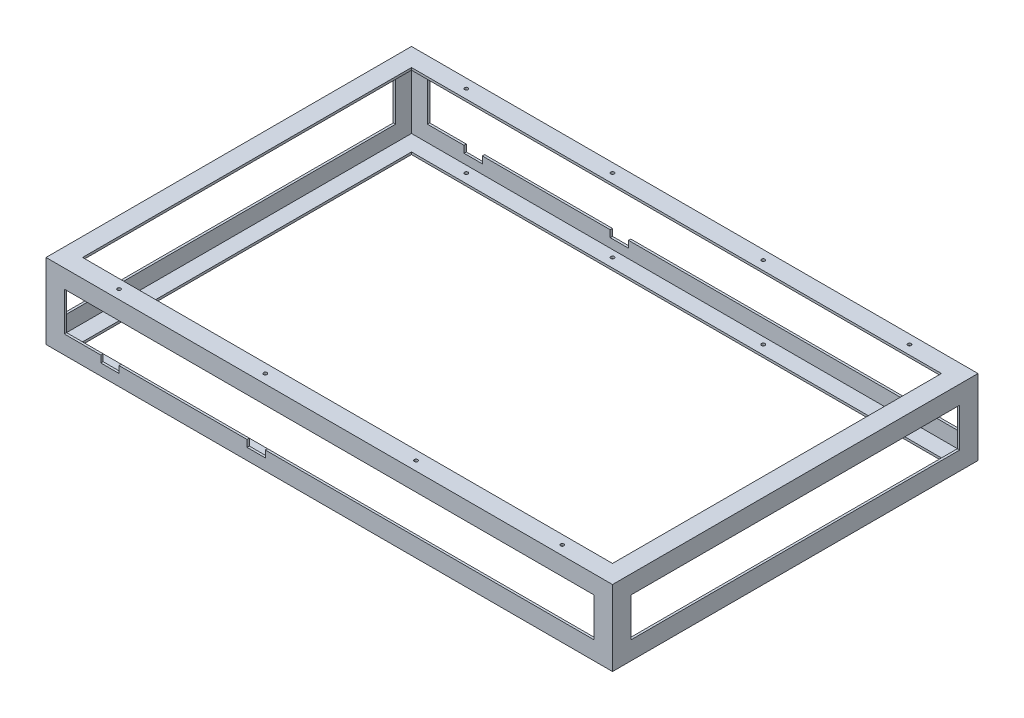
from build123d import *

# Parameters (mm, degrees)
X_ANGLE_LENTH_DEPTH             = 1574.8
X_ANGLE_LENTH_2_DEPTH           = 1574.8
X_ANGLE_LENTH_3_DEPTH           = 1574.8
X_ANGLE_LENTH_4_DEPTH           = 1574.8
Y_ANGLE_LENTH_DEPTH             = 209.55
Z_ANGLE_LENTH_REACH             = 1684.546
Z_ANGLE_LENTH_DIRECTION_2_REACH = 1684.546
SKETCH16_R                      = 4.7625
WHEEL_MOUNT_LOC_HOLES_DEPTH     = 1668.923931869
SKETCH17_W                      = 50.8
SKETCH17_H                      = 38.1
FRONT_CONTROL_ARM_CUTOUTS_DEPTH = 1899.724329649


with BuildPart() as part:
    # Sketch5 → X Angle Lenth (new body)
    with BuildSketch(Plane(origin=(0, 0, 0), x_dir=(0, 0, -1), z_dir=(1, 0, 0))):
        Polygon((-508, -304.8), (-508, -254), (-501.65, -254), (-501.65, -298.45), (-457.2, -298.45), (-457.2, -304.8), align=None)
    extrude(amount=X_ANGLE_LENTH_DEPTH)



with BuildPart() as body_2:
    # Sketch5 → X Angle Lenth 2 (new body)
    with BuildSketch(Plane(origin=(0, 0, 0), x_dir=(0, 0, -1), z_dir=(1, 0, 0))):
        Polygon((501.65, -254), (508, -254), (508, -304.8), (457.2, -304.8), (457.2, -298.45), (501.65, -298.45), align=None)
    extrude(amount=X_ANGLE_LENTH_2_DEPTH)


with BuildPart() as body_3:
    # Sketch5 → X Angle Lenth 3 (new body)
    with BuildSketch(Plane(origin=(0, 0, 0), x_dir=(0, 0, -1), z_dir=(1, 0, 0))):
        Polygon((508, -95.25), (508, -146.05), (501.65, -146.05), (501.65, -101.6), (457.2, -101.6), (457.2, -95.25), align=None)
    extrude(amount=X_ANGLE_LENTH_3_DEPTH)


with BuildPart() as body_4:
    # Sketch5 → X Angle Lenth 4 (new body)
    with BuildSketch(Plane(origin=(0, 0, 0), x_dir=(0, 0, -1), z_dir=(1, 0, 0))):
        Polygon((-501.65, -146.05), (-508, -146.05), (-508, -95.25), (-457.2, -95.25), (-457.2, -101.6), (-501.65, -101.6), align=None)
    extrude(amount=X_ANGLE_LENTH_4_DEPTH)


with BuildPart() as part_1:
    add(part.part)

    add(body_2.part)  # Y Angle Lenth merges body 2

    add(body_3.part)  # Y Angle Lenth merges body 3

    add(body_4.part)  # Y Angle Lenth merges body 4
    # Sketch6 → Y Angle Lenth (add)
    with BuildSketch(Plane.XZ.offset(304.8)):
        Polygon((1574.8, -508), (1524, -508), (1524, -501.65), (1568.45, -501.65), (1568.45, -457.2), (1574.8, -457.2), align=None)
        Polygon((1524, 501.65), (1524, 508), (1574.8, 508), (1574.8, 457.2), (1568.45, 457.2), (1568.45, 501.65), align=None)
        Polygon((0, 508), (50.8, 508), (50.8, 501.65), (6.35, 501.65), (6.35, 457.2), (0, 457.2), align=None)
        Polygon((50.8, -501.65), (50.8, -508), (0, -508), (0, -457.2), (6.35, -457.2), (6.35, -501.65), align=None)
    extrude(amount=-Y_ANGLE_LENTH_DEPTH)

    # Sketch15 → Z Angle Lenth (add, up to next)
    with BuildSketch(Plane.XY, mode=Mode.PRIVATE) as z_angle_lenth_sk1:
        Polygon((0, -254), (0, -304.8), (50.8, -304.8), (50.8, -298.45), (6.35, -298.45), (6.35, -254), align=None)
    z_angle_lenth_tool1 = extrude(z_angle_lenth_sk1.sketch, amount=-Z_ANGLE_LENTH_REACH, mode=Mode.PRIVATE) - part_1.part
    # Sketch15 → Z Angle Lenth (add, up to next)
    with BuildSketch(Plane.XY, mode=Mode.PRIVATE) as z_angle_lenth_sk2:
        Polygon((1568.45, -254), (1574.8, -254), (1574.8, -304.8), (1524, -304.8), (1524, -298.45), (1568.45, -298.45), align=None)
    z_angle_lenth_tool2 = extrude(z_angle_lenth_sk2.sketch, amount=-Z_ANGLE_LENTH_REACH, mode=Mode.PRIVATE) - part_1.part
    # Sketch15 → Z Angle Lenth (add, up to next)
    with BuildSketch(Plane.XY, mode=Mode.PRIVATE) as z_angle_lenth_sk3:
        Polygon((1574.8, -146.05), (1574.8, -95.25), (1524, -95.25), (1524, -101.6), (1568.45, -101.6), (1568.45, -146.05), align=None)
    z_angle_lenth_tool3 = extrude(z_angle_lenth_sk3.sketch, amount=-Z_ANGLE_LENTH_REACH, mode=Mode.PRIVATE) - part_1.part
    # Sketch15 → Z Angle Lenth (add, up to next)
    with BuildSketch(Plane.XY, mode=Mode.PRIVATE) as z_angle_lenth_sk4:
        Polygon((6.35, -146.05), (0, -146.05), (0, -95.25), (50.8, -95.25), (50.8, -101.6), (6.35, -101.6), align=None)
    z_angle_lenth_tool4 = extrude(z_angle_lenth_sk4.sketch, amount=-Z_ANGLE_LENTH_REACH, mode=Mode.PRIVATE) - part_1.part
    add(z_angle_lenth_tool1.solids().sort_by_distance((0.71842, -279.4, 0))[0])
    add(z_angle_lenth_tool2.solids().sort_by_distance((1571.625, -254.71842, 0))[0])
    add(z_angle_lenth_tool3.solids().sort_by_distance((1574.08158, -120.65, 0))[0])
    add(z_angle_lenth_tool4.solids().sort_by_distance((3.175, -145.33158, 0))[0])

    # Sketch15 → Z Angle Lenth direction 2 (add, up to next)
    with BuildSketch(Plane.XY, mode=Mode.PRIVATE) as z_angle_lenth_direction_2_sk1:
        Polygon((0, -254), (0, -304.8), (50.8, -304.8), (50.8, -298.45), (6.35, -298.45), (6.35, -254), align=None)
    z_angle_lenth_direction_2_tool1 = extrude(z_angle_lenth_direction_2_sk1.sketch, amount=Z_ANGLE_LENTH_DIRECTION_2_REACH, mode=Mode.PRIVATE) - part_1.part
    # Sketch15 → Z Angle Lenth direction 2 (add, up to next)
    with BuildSketch(Plane.XY, mode=Mode.PRIVATE) as z_angle_lenth_direction_2_sk2:
        Polygon((1568.45, -254), (1574.8, -254), (1574.8, -304.8), (1524, -304.8), (1524, -298.45), (1568.45, -298.45), align=None)
    z_angle_lenth_direction_2_tool2 = extrude(z_angle_lenth_direction_2_sk2.sketch, amount=Z_ANGLE_LENTH_DIRECTION_2_REACH, mode=Mode.PRIVATE) - part_1.part
    # Sketch15 → Z Angle Lenth direction 2 (add, up to next)
    with BuildSketch(Plane.XY, mode=Mode.PRIVATE) as z_angle_lenth_direction_2_sk3:
        Polygon((1574.8, -146.05), (1574.8, -95.25), (1524, -95.25), (1524, -101.6), (1568.45, -101.6), (1568.45, -146.05), align=None)
    z_angle_lenth_direction_2_tool3 = extrude(z_angle_lenth_direction_2_sk3.sketch, amount=Z_ANGLE_LENTH_DIRECTION_2_REACH, mode=Mode.PRIVATE) - part_1.part
    # Sketch15 → Z Angle Lenth direction 2 (add, up to next)
    with BuildSketch(Plane.XY, mode=Mode.PRIVATE) as z_angle_lenth_direction_2_sk4:
        Polygon((6.35, -146.05), (0, -146.05), (0, -95.25), (50.8, -95.25), (50.8, -101.6), (6.35, -101.6), align=None)
    z_angle_lenth_direction_2_tool4 = extrude(z_angle_lenth_direction_2_sk4.sketch, amount=Z_ANGLE_LENTH_DIRECTION_2_REACH, mode=Mode.PRIVATE) - part_1.part
    add(z_angle_lenth_direction_2_tool1.solids().sort_by_distance((0.71842, -279.4, 0))[0])
    add(z_angle_lenth_direction_2_tool2.solids().sort_by_distance((1571.625, -254.71842, 0))[0])
    add(z_angle_lenth_direction_2_tool3.solids().sort_by_distance((1574.08158, -120.65, 0))[0])
    add(z_angle_lenth_direction_2_tool4.solids().sort_by_distance((3.175, -145.33158, 0))[0])

    # Sketch16 → Wheel Mount LOC Holes (cut, through all)
    with BuildSketch(Plane(origin=(0, -95.25, 0), x_dir=(1, 0, 0), z_dir=(0, 1, 0))):
        with Locations((1409.7, 482.6)):
            Circle(SKETCH16_R)
        with Locations((1003.3, 482.6)):
            Circle(SKETCH16_R)
        with Locations((584.2, 482.6)):
            Circle(SKETCH16_R)
        with Locations((177.8, 482.6)):
            Circle(SKETCH16_R)
        with Locations((177.8, -482.6)):
            Circle(SKETCH16_R)
        with Locations((584.2, -482.6)):
            Circle(SKETCH16_R)
        with Locations((1003.3, -482.6)):
            Circle(SKETCH16_R)
        with Locations((1409.7, -482.6)):
            Circle(SKETCH16_R)
    extrude(amount=-WHEEL_MOUNT_LOC_HOLES_DEPTH, mode=Mode.SUBTRACT)

    # Sketch17 → Front Control Arm Cutouts (cut, through all)
    with BuildSketch(Plane.XY.offset(508)):
        with Locations((177.8, -254)):
            Rectangle(SKETCH17_W, SKETCH17_H)
        with Locations((584.2, -254)):
            Rectangle(SKETCH17_W, SKETCH17_H)
    extrude(amount=-FRONT_CONTROL_ARM_CUTOUTS_DEPTH, mode=Mode.SUBTRACT)


solid = part_1.part
